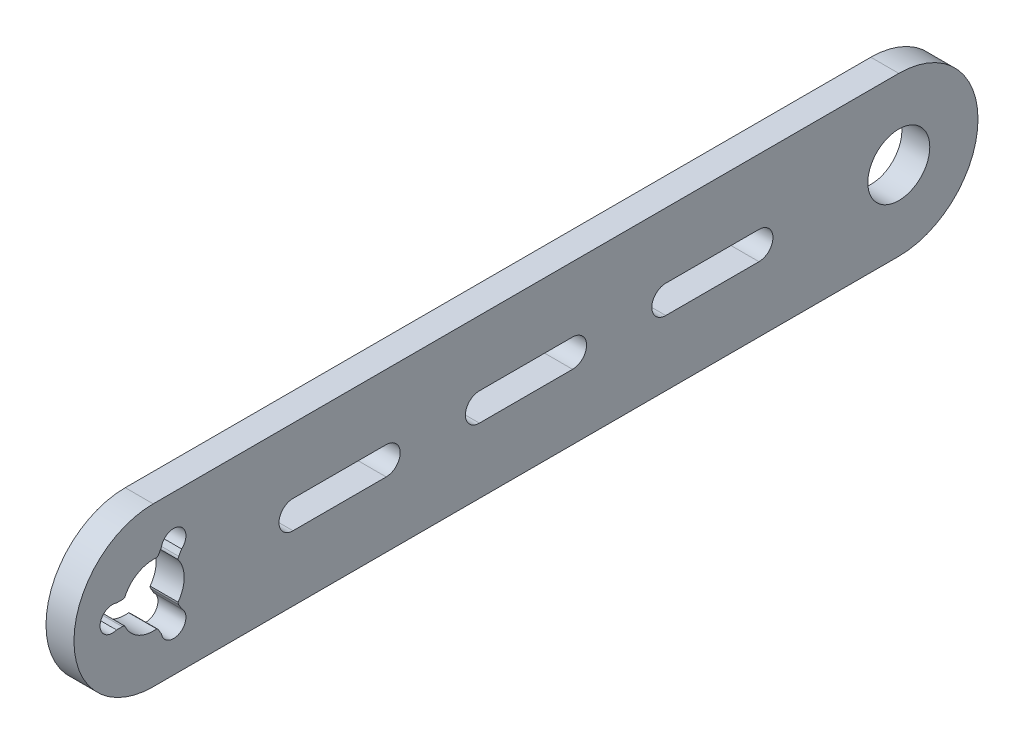
from build123d import *

# Parameters (mm, degrees)
CUT_EXTRUDE_START       = -6
CUT_EXTRUDE_4_OUTLINE_R = 6.5
CUT_EXTRUDE_4_DEPTH     = 6
SKETCH_1_6_R            = 6.65
CUT_EXTRUDE_5_DEPTH     = 10
SKETCH_1_7_W            = 120.462330866
SKETCH_1_7_H            = 12.505444566
EXTRUDE_1_DEPTH         = 6
CUT_EXTRUDE_6_DEPTH     = 6
EXTRUDE_START           = -6
SKETCH_3_R              = 6.65
EXTRUDE_3_DEPTH         = 6


with BuildPart() as part:
    # 切除-拉伸4: read off the stored shape, not the designer's step
    # 切除-拉伸4 outline → 切除-拉伸4 (new body)
    with BuildSketch(Plane.ZY.offset(3).offset(CUT_EXTRUDE_START)):
        with BuildLine():
            Line((-160, -12), (-16.278820596, -12))
            ThreePointArc((-16.278820596, -12), (-12.755499279, -12.528896875), (-9.542756901, -14.068965517))
            ThreePointArc((-9.542756901, -14.068965517), (17, 0), (-9.542756901, 14.068965517))
            ThreePointArc((-9.542756901, 14.068965517), (-12.755499279, 12.528896875), (-16.278820596, 12))
            Line((-16.278820596, 12), (-160, 12))
            ThreePointArc((-160, 12), (-172, 0), (-160, -12))
        make_face()
        with Locations((-160, 0)):
            Circle(CUT_EXTRUDE_4_OUTLINE_R, mode=Mode.SUBTRACT)
        with BuildLine():
            Line((-120, -3), (-134, -3))
            ThreePointArc((-134, -3), (-137, 0), (-134, 3))
            Line((-134, 3), (-120, 3))
            ThreePointArc((-120, 3), (-117, 0), (-120, -3))
        make_face(mode=Mode.SUBTRACT)
        with BuildLine():
            Line((-90, -3), (-104, -3))
            ThreePointArc((-104, -3), (-107, 0), (-104, 3))
            Line((-104, 3), (-90, 3))
            ThreePointArc((-90, 3), (-87, 0), (-90, -3))
        make_face(mode=Mode.SUBTRACT)
        with BuildLine():
            Line((-60, -3), (-74, -3))
            ThreePointArc((-74, -3), (-77, 0), (-74, 3))
            Line((-74, 3), (-60, 3))
            ThreePointArc((-60, 3), (-57, 0), (-60, -3))
        make_face(mode=Mode.SUBTRACT)
        with BuildLine():
            Line((-30, -3), (-44, -3))
            ThreePointArc((-44, -3), (-47, 0), (-44, 3))
            Line((-44, 3), (-30, 3))
            ThreePointArc((-30, 3), (-27, 0), (-30, -3))
        make_face(mode=Mode.SUBTRACT)
        with BuildLine():
            ThreePointArc((-5.4816883, -4.494562647), (-5.376440838, -4.232531174), (-5.348640266, -3.951524681))
            ThreePointArc((-5.348640266, -3.951524681), (-6.65, 0), (-5.348640266, 3.951524681))
            ThreePointArc((-5.348640266, 3.951524681), (-5.376440838, 4.232531174), (-5.4816883, 4.494562647))
            Line((-5.4816883, 4.494562647), (-6.100603614, 5.566555416))
            ThreePointArc((-6.100603614, 5.566555416), (-5.7, 9.872689603), (-1.770476595, 8.066555416))
            Line((-1.770476595, 8.066555416), (-1.151561281, 6.994562647))
            ThreePointArc((-1.151561281, 6.994562647), (-0.9772591, 6.772399934), (-0.747800624, 6.607820687))
            ThreePointArc((-0.747800624, 6.607820687), (3.325, 5.759068935), (6.09644089, 2.656296006))
            ThreePointArc((6.09644089, 2.656296006), (6.353699938, 2.53986876), (6.633249581, 2.5))
            Line((6.633249581, 2.5), (7.871080208, 2.5))
            ThreePointArc((7.871080208, 2.5), (11.4, 0), (7.871080208, -2.5))
            Line((7.871080208, -2.5), (6.633249581, -2.5))
            ThreePointArc((6.633249581, -2.5), (6.353699938, -2.53986876), (6.09644089, -2.656296006))
            ThreePointArc((6.09644089, -2.656296006), (3.325, -5.759068935), (-0.747800624, -6.607820687))
            ThreePointArc((-0.747800624, -6.607820687), (-0.9772591, -6.772399934), (-1.151561281, -6.994562647))
            Line((-1.151561281, -6.994562647), (-1.770476595, -8.066555416))
            ThreePointArc((-1.770476595, -8.066555416), (-5.7, -9.872689603), (-6.100603614, -5.566555416))
            Line((-6.100603614, -5.566555416), (-5.4816883, -4.494562647))
        make_face(mode=Mode.SUBTRACT)
    extrude(amount=CUT_EXTRUDE_4_DEPTH)

    # 草图1<6> → 切除-拉伸5 (cut)
    with BuildSketch(Plane.ZY.offset(3)):
        with Locations((-160, 0)):
            Circle(SKETCH_1_6_R)
    extrude(amount=-CUT_EXTRUDE_5_DEPTH, mode=Mode.SUBTRACT)

    # 草图1<7> → 凸台-拉伸1 (add)
    with BuildSketch(Plane.ZY.offset(3)):
        with Locations((-81.625615337, 0)):
            Rectangle(SKETCH_1_7_W, SKETCH_1_7_H)
    extrude(amount=-EXTRUDE_1_DEPTH)

    # 草图2 → 切除-拉伸6 (cut)
    with BuildSketch(Plane.ZY.offset(3)):
        with BuildLine():
            Line((-130, 3), (-110, 3))
            ThreePointArc((-110, 3), (-107, 0), (-110, -3))
            Line((-110, -3), (-130, -3))
            ThreePointArc((-130, -3), (-133, 0), (-130, 3))
        make_face()
        with BuildLine():
            Line((-90, 3), (-70, 3))
            ThreePointArc((-70, 3), (-67, 0), (-70, -3))
            Line((-70, -3), (-90, -3))
            ThreePointArc((-90, -3), (-93, 0), (-90, 3))
        make_face()
        with BuildLine():
            Line((-50, 3), (-30, 3))
            ThreePointArc((-30, 3), (-27, 0), (-30, -3))
            Line((-30, -3), (-50, -3))
            ThreePointArc((-50, -3), (-53, 0), (-50, 3))
        make_face()
    extrude(amount=-CUT_EXTRUDE_6_DEPTH, mode=Mode.SUBTRACT)

    # 草图3 → 凸台-拉伸3 (add)
    # profile 1 of 6: a face of its own
    with BuildSketch(Plane.ZY.offset(3).offset(EXTRUDE_START)):
        with BuildLine():
            Line((0, 17), (-160, 17))
            ThreePointArc((-160, 17), (-153.480797595, 15.700318468), (-147.958405421, 12))
            Line((-147.958405421, 12), (-16.278820596, 12))
            ThreePointArc((-16.278820596, 12), (-12.755499279, 12.528896875), (-9.542756901, 14.068965517))
            ThreePointArc((-9.542756901, 14.068965517), (-4.991371866, 16.250729427), (0, 17))
        make_face()
    # profile 2 of 6: a face of its own
    with BuildSketch(Plane.ZY.offset(3).offset(EXTRUDE_START)):
        with BuildLine():
            Line((-16.278820596, 12), (-147.958405421, 12))
            ThreePointArc((-147.958405421, 12), (-146.052319534, 9.719167126), (-144.57264474, 7.141198057))
            Line((-144.57264474, 7.141198057), (-15.42735526, 7.141198057))
            ThreePointArc((-15.42735526, 7.141198057), (-12.95666299, 11.005675089), (-9.542756901, 14.068965517))
            ThreePointArc((-9.542756901, 14.068965517), (-12.755499279, 12.528896875), (-16.278820596, 12))
        make_face()
    # profile 3 of 6: a face of its own
    with BuildSketch(Plane.ZY.offset(3).offset(EXTRUDE_START)):
        with BuildLine():
            ThreePointArc((-143.664552767, -4.706714744), (-145.350353999, -8.624840407), (-147.958405421, -12))
            Line((-147.958405421, -12), (-16.278820596, -12))
            ThreePointArc((-16.278820596, -12), (-12.755499279, -12.528896875), (-9.542756901, -14.068965517))
            ThreePointArc((-9.542756901, -14.068965517), (-13.759843647, -9.983321231), (-16.335447233, -4.706714744))
            Line((-16.335447233, -4.706714744), (-143.664552767, -4.706714744))
        make_face()
    # profile 4 of 6: a face of its own
    with BuildSketch(Plane.ZY.offset(3).offset(EXTRUDE_START)):
        with BuildLine():
            ThreePointArc((-147.958405421, -12), (-153.480797595, -15.700318468), (-160, -17))
            Line((-160, -17), (0, -17))
            ThreePointArc((0, -17), (-4.991371866, -16.250729427), (-9.542756901, -14.068965517))
            ThreePointArc((-9.542756901, -14.068965517), (-12.755499279, -12.528896875), (-16.278820596, -12))
            Line((-16.278820596, -12), (-147.958405421, -12))
        make_face()
    # profile 5 of 6: a face of its own
    with BuildSketch(Plane.ZY.offset(3).offset(EXTRUDE_START)):
        with BuildLine():
            ThreePointArc((-144.57264474, 7.141198057), (-146.052319534, 9.719167126), (-147.958405421, 12))
            Line((-147.958405421, 12), (-160, 12))
            ThreePointArc((-160, 12), (-172, 0), (-160, -12))
            Line((-160, -12), (-147.958405421, -12))
            ThreePointArc((-147.958405421, -12), (-145.350353999, -8.624840407), (-143.664552767, -4.706714744))
            ThreePointArc((-143.664552767, -4.706714744), (-143.166958044, -2.37669908), (-143, 0))
            ThreePointArc((-143, 0), (-143.397815815, 3.656156492), (-144.57264474, 7.141198057))
        make_face()
        with Locations((-160, 0)):
            Circle(SKETCH_3_R, mode=Mode.SUBTRACT)
    # profile 6 of 6: a face of its own
    with BuildSketch(Plane.ZY.offset(3).offset(EXTRUDE_START)):
        with BuildLine():
            ThreePointArc((-147.958405421, 12), (-153.480797595, 15.700318468), (-160, 17))
            ThreePointArc((-160, 17), (-177, 0), (-160, -17))
            ThreePointArc((-160, -17), (-153.480797595, -15.700318468), (-147.958405421, -12))
            Line((-147.958405421, -12), (-160, -12))
            ThreePointArc((-160, -12), (-172, 0), (-160, 12))
            Line((-160, 12), (-147.958405421, 12))
        make_face()
    extrude(amount=EXTRUDE_3_DEPTH)


solid = part.part
